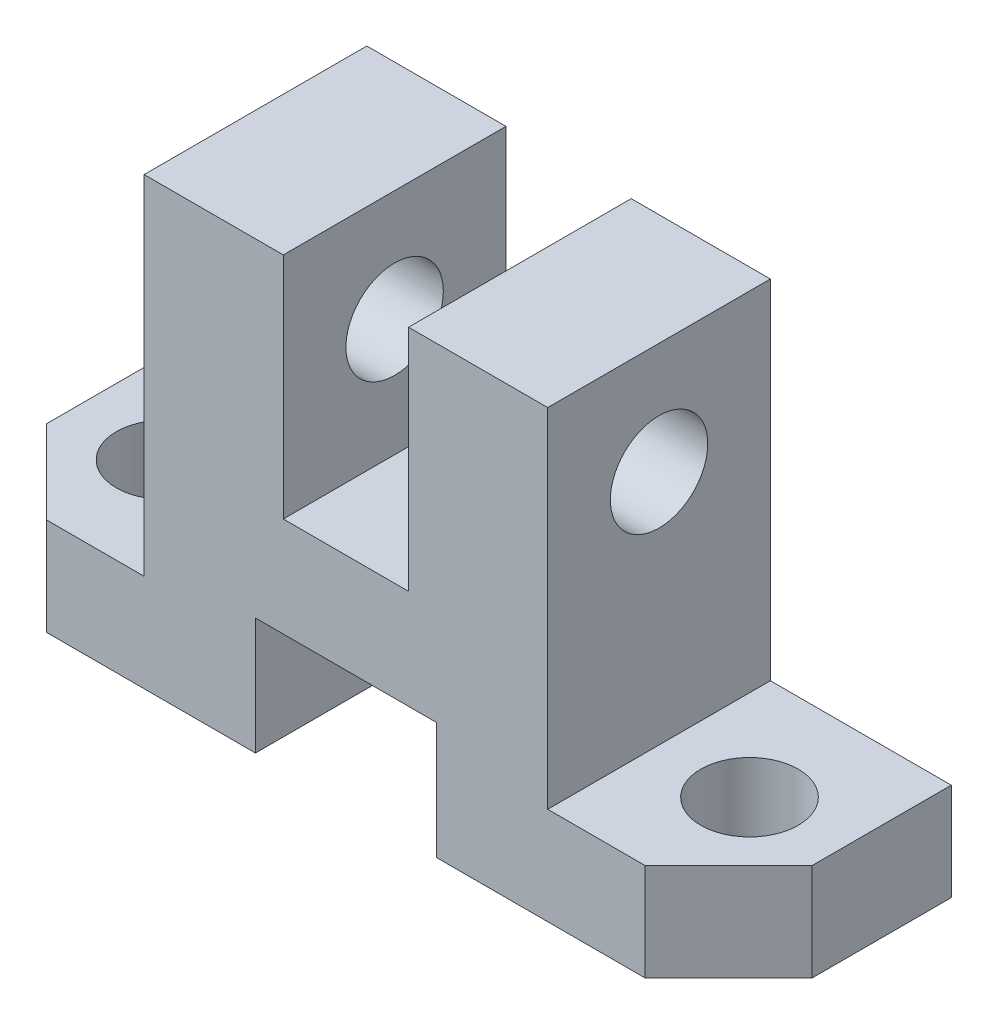
from build123d import *

# Parameters (mm, degrees)
BOSS_EXTRUDE1_DEPTH = 8
CHAMFER2_START      = 20.859650045
CHAMFER2_OUTLINE_W  = 12
CHAMFER2_OUTLINE_H  = 7
CHAMFER2_DEPTH      = 5.140349955
CHAMFER3_START      = -26
CHAMFER3_OUTLINE_W  = 12
CHAMFER3_OUTLINE_H  = 7
CHAMFER3_DEPTH      = 5.140349955
SKETCH2_R           = 3.5
CUT_EXTRUDE1_DEPTH  = 16
SKETCH3_R           = 3.5
CUT_EXTRUDE2_DEPTH  = 49.833796009


with BuildPart() as part:
    # Sketch1 → Boss-Extrude1 (new, symmetric)
    with BuildSketch(Plane.XY):
        Polygon((-6.5, 0), (6.5, 0), (6.5, -8.404669261), (27.5, -8.404669261), (27.5, -1.404669261), (14.5, -1.404669261), (14.5, 23.595330739), (4.5, 23.595330739), (4.5, 7.159533074), (-4.5, 7.159533074), (-4.5, 23.595330739), (-14.5, 23.595330739), (-14.5, -1.404669261), (-27.5, -1.404669261), (-27.5, -8.404669261), (-6.5, -8.404669261), align=None)
    extrude(amount=BOSS_EXTRUDE1_DEPTH, both=True)

    # Chamfer2: read off the stored shape, not the designer's step
    # Chamfer2 outline → Chamfer2 (cut)
    with BuildSketch(Plane(origin=(0, 0, 0), x_dir=(0.7071067811865474, 0, -0.7071067811865477), z_dir=(0.7071067811865476, 0, 0.7071067811865476)).offset(CHAMFER2_START)):
        with Locations((14, -4.904669261)):
            Rectangle(CHAMFER2_OUTLINE_W, CHAMFER2_OUTLINE_H)
    extrude(amount=CHAMFER2_DEPTH, mode=Mode.SUBTRACT)

    # Chamfer3: read off the stored shape, not the designer's step
    # Chamfer3 outline → Chamfer3 (cut)
    with BuildSketch(Plane(origin=(0, 0, 0), x_dir=(0.707106781186548, 0, 0.707106781186547), z_dir=(0.707106781186547, 0, -0.707106781186548)).offset(CHAMFER3_START)):
        with Locations((-14, 4.904669261)):
            Rectangle(CHAMFER3_OUTLINE_W, CHAMFER3_OUTLINE_H)
    extrude(amount=CHAMFER3_DEPTH, mode=Mode.SUBTRACT)

    # Sketch2 → Cut-Extrude1 (cut)
    with BuildSketch(Plane(origin=(0, -1.404669261, 0), x_dir=(1, 0, 0), z_dir=(0, 1, 0))):
        with Locations(Location((21, 0, 0), (0, 0, 180))):
            Circle(SKETCH2_R)
    cut_extrude1 = extrude(amount=-CUT_EXTRUDE1_DEPTH, mode=Mode.SUBTRACT)

    # Mirror1: Cut-Extrude1 across plane
    add(cut_extrude1.mirror(Plane(origin=(0, 0, 0), x_dir=(0, 0, 1), z_dir=(1, 0, 0))), mode=Mode.SUBTRACT)

    # Sketch3 → Cut-Extrude2 (cut, through all)
    with BuildSketch(Plane(origin=(14.5, 0, 0), x_dir=(0, 0, -1), z_dir=(1, 0, 0))):
        with Locations((0, 15.595330739)):
            Circle(SKETCH3_R)
    extrude(amount=-CUT_EXTRUDE2_DEPTH, mode=Mode.SUBTRACT)


solid = part.part
